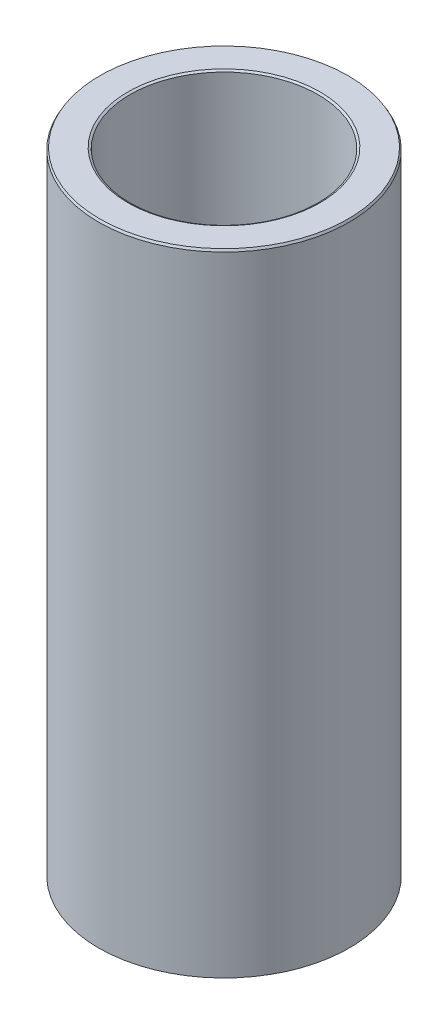
from build123d import *
from OCP.BRepFilletAPI import BRepFilletAPI_MakeChamfer

# Parameters (mm, degrees)
SKETCH1_R           = 55
BOSS_EXTRUDE1_DEPTH = 277.299631456
SKETCH2_R           = 41.22485275
CUT_EXTRUDE1_DEPTH  = 289.001884726
CHAMFER1_SIZE       = 0.935662917
CHAMFER1_SIZE2      = 0.540205237


with BuildPart() as part:
    # Sketch1 → Boss-Extrude1 (new body)
    with BuildSketch(Plane(origin=(0, 0, 0), x_dir=(1, 0, 0), z_dir=(0, 1, 0))):
        Circle(SKETCH1_R)
    extrude(amount=BOSS_EXTRUDE1_DEPTH)

    # Sketch2 → Cut-Extrude1 (cut, through all)
    with BuildSketch(Plane(origin=(0, 0, 0), x_dir=(1, 0, 0), z_dir=(0, 1, 0))):
        Circle(SKETCH2_R)
    extrude(amount=CUT_EXTRUDE1_DEPTH, mode=Mode.SUBTRACT)

    # Chamfer1: one chamfer whose edges measure the first distance from different faces: ONE call of the kernel's chamfer builder (chamfer() names one face for all edges)
    chamfer1_edges_1 = [part.edges().sort_by_distance(p)[0] for p in [
        (-41.22485275, 277.299631456, 0),
    ]]
    chamfer1_side_1 = [part.faces().sort_by_distance(p)[0] for p in [
        (-53.444365081, 277.299631456, 0),
    ]]
    chamfer1_edges_2 = [part.edges().sort_by_distance(p)[0] for p in [
        (-41.22485275, 0, 0),
    ]]
    chamfer1_side_2 = [part.faces().sort_by_distance(p)[0] for p in [
        (-41.22485275, 138.649815728, 0),
    ]]
    chamfer1_edges_3 = [part.edges().sort_by_distance(p)[0] for p in [
        (-55, 0, 0),
    ]]
    chamfer1_side_3 = [part.faces().sort_by_distance(p)[0] for p in [
        (-53.444365081, 0, 0),
    ]]
    chamfer1_edges_4 = [part.edges().sort_by_distance(p)[0] for p in [
        (-55, 277.299631456, 0),
    ]]
    chamfer1_side_4 = [part.faces().sort_by_distance(p)[0] for p in [
        (-55, 138.649815728, 0),
    ]]
    chamfer1 = BRepFilletAPI_MakeChamfer(part.part.solid().wrapped)
    for e in chamfer1_edges_1:
        chamfer1.Add(CHAMFER1_SIZE, CHAMFER1_SIZE2, e.wrapped, chamfer1_side_1[0].wrapped)  # the first distance lies on this face
    for e in chamfer1_edges_2:
        chamfer1.Add(CHAMFER1_SIZE, CHAMFER1_SIZE2, e.wrapped, chamfer1_side_2[0].wrapped)  # the first distance lies on this face
    for e in chamfer1_edges_3:
        chamfer1.Add(CHAMFER1_SIZE, CHAMFER1_SIZE2, e.wrapped, chamfer1_side_3[0].wrapped)  # the first distance lies on this face
    for e in chamfer1_edges_4:
        chamfer1.Add(CHAMFER1_SIZE, CHAMFER1_SIZE2, e.wrapped, chamfer1_side_4[0].wrapped)  # the first distance lies on this face
    add(Compound.cast(chamfer1.Shape()), mode=Mode.REPLACE)


solid = part.part
